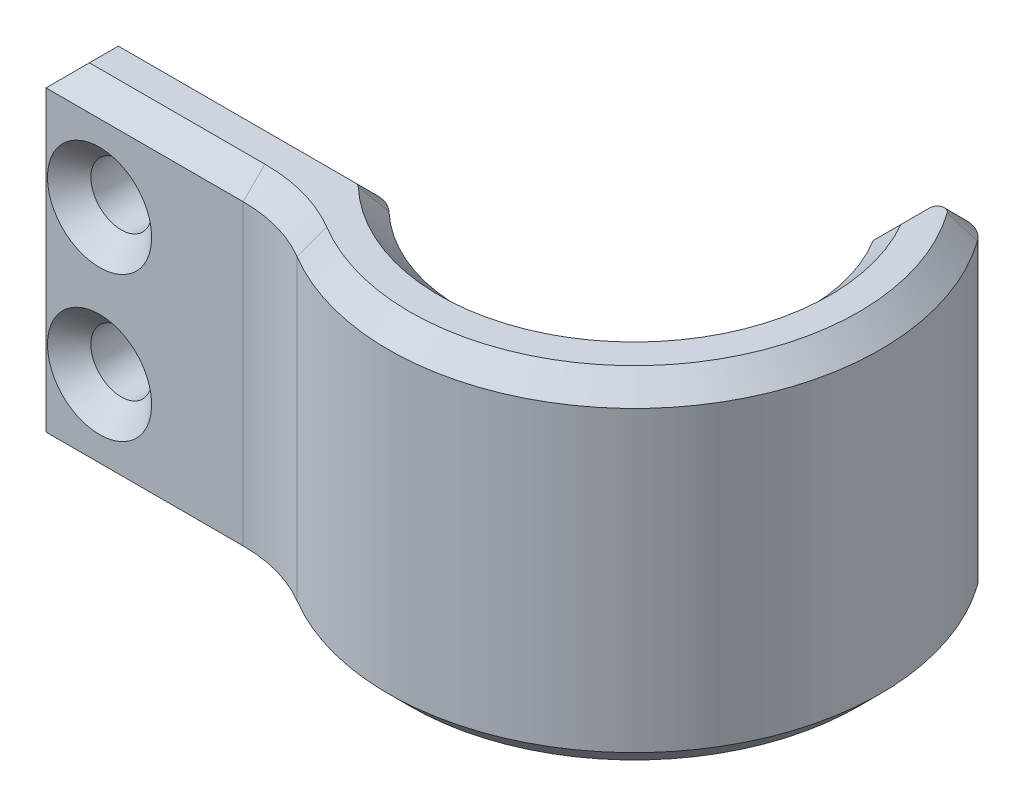
from build123d import *

# Parameters (mm, degrees)
CROQUIS1_W                          = 15.5
CROQUIS1_H                          = 23.6
CROQUIS1_R                          = 2.1
SALIENTE_EXTRUIR1_DEPTH             = 5
SALIENTE_EXTRUIR2_REACH             = 40.26
SALIENTE_EXTRUIR2_DIRECTION_2_REACH = 40.26
REDONDEO1_R                         = 2
REDONDEO2_R                         = 10
CHAFL_N1_SIZE                       = 1.5
CHAFL_N2_SIZE                       = 1.5


with BuildPart() as part:
    # Croquis1 → Saliente-Extruir1 (new body)
    with BuildSketch(Plane.XY):
        with Locations((28.3, 0)):
            Rectangle(CROQUIS1_W, CROQUIS1_H)
        with Locations((24.250000128, -5)):
            Circle(CROQUIS1_R, mode=Mode.SUBTRACT)
        with Locations((24.250000128, 5)):
            Circle(CROQUIS1_R, mode=Mode.SUBTRACT)
    extrude(amount=SALIENTE_EXTRUIR1_DEPTH)

    # Saliente-Extruir2: up to this face of the body (flat: up to its plane)
    saliente_extruir2_end = Plane(part.part.faces().sort_by_distance((28.3, -11.8, 2.5))[0])
    # Croquis2 → Saliente-Extruir2 (add, up to the picked face)
    with BuildSketch(Plane(origin=(0, 0, 0), x_dir=(1, 0, 0), z_dir=(0, 1, 0)), mode=Mode.PRIVATE) as saliente_extruir2_sk1:
        with BuildLine():
            Line((36.05, 0), (36.05, -5))
            Line((36.05, -5), (37.292908876, -5))
            ThreePointArc((37.292908876, -5), (61.427658114, -2.326136764), (58.268482288, 21.749894336))
            Line((58.268482288, 21.749894336), (58.268482288, 14.455247679))
            ThreePointArc((58.268482288, 14.455247679), (55.312581622, -1.388967795), (39.254957851, 0))
            Line((39.254957851, 0), (36.05, 0))
        make_face()
    saliente_extruir2_tool1 = split(extrude(saliente_extruir2_sk1.sketch, amount=-SALIENTE_EXTRUIR2_REACH, mode=Mode.PRIVATE), bisect_by=saliente_extruir2_end, keep=Keep.BOTH, mode=Mode.PRIVATE)
    add(saliente_extruir2_tool1.solids().sort_by(Axis((37.652479, 0, 0.421487), (0, -1, 0)))[0])

    # Saliente-Extruir2 direction 2: up to this face of the body (flat: up to its plane)
    saliente_extruir2_direction_2_end = Plane(part.part.faces().sort_by_distance((28.3, 11.8, 2.5))[0])
    # Croquis2 → Saliente-Extruir2 direction 2 (add, up to the picked face)
    with BuildSketch(Plane(origin=(0, 0, 0), x_dir=(1, 0, 0), z_dir=(0, 1, 0)), mode=Mode.PRIVATE) as saliente_extruir2_direction_2_sk1:
        with BuildLine():
            Line((36.05, 0), (36.05, -5))
            Line((36.05, -5), (37.292908876, -5))
            ThreePointArc((37.292908876, -5), (61.427658114, -2.326136764), (58.268482288, 21.749894336))
            Line((58.268482288, 21.749894336), (58.268482288, 14.455247679))
            ThreePointArc((58.268482288, 14.455247679), (55.312581622, -1.388967795), (39.254957851, 0))
            Line((39.254957851, 0), (36.05, 0))
        make_face()
    saliente_extruir2_direction_2_tool1 = split(extrude(saliente_extruir2_direction_2_sk1.sketch, amount=SALIENTE_EXTRUIR2_DIRECTION_2_REACH, mode=Mode.PRIVATE), bisect_by=saliente_extruir2_direction_2_end, keep=Keep.BOTH, mode=Mode.PRIVATE)
    add(saliente_extruir2_direction_2_tool1.solids().sort_by(Axis((37.652479, 0, 0.421487), (0, 1, 0)))[0])

    # Redondeo1
    redondeo1_edges = [part.edges().sort_by_distance(p)[0] for p in [
        (39.254957851, 0, 0),
        (58.268482288, 0, -21.749894336),
    ]]
    fillet(redondeo1_edges, radius=REDONDEO1_R)

    # Redondeo2
    redondeo2_edges = [part.edges().sort_by_distance(p)[0] for p in [
        (37.292908876, 0, 5),
    ]]
    fillet(redondeo2_edges, radius=REDONDEO2_R)

    # Chaflán1
    chafl_n1_edges = [part.edges().sort_by_distance(p)[0] for p in [
        (58.268482288, 11.8, -15.660048739),
        (59.659492117, 11.8, -18.769877613),
        (60.537424453, 11.8, 3.37157131),
        (36.843099013, 11.8, 5.361749074),
        (27.363871837, 11.8, 5),
        (20.55, 11.8, 2.5),
        (29.486018705, 11.8, 0),
        (39.162329274, 11.8, 0.142052757),
        (55.615767212, 11.8, 1.150684381),
        (20.55, -11.8, 2.5),
        (27.363871837, -11.8, 5),
        (36.843099013, -11.8, 5.361749074),
        (60.537424453, -11.8, 3.37157131),
        (59.659492117, -11.8, -18.769877613),
        (58.268482288, -11.8, -15.660048739),
        (55.615767212, -11.8, 1.150684381),
        (39.162329274, -11.8, 0.142052757),
        (29.486018705, -11.8, 0),
    ]]
    chamfer(chafl_n1_edges, length=CHAFL_N1_SIZE)

    # Chaflán2
    chafl_n2_edges = [part.edges().sort_by_distance(p)[0] for p in [
        (22.150000128, 5, 5),
        (22.150000128, -5, 5),
    ]]
    chamfer(chafl_n2_edges, length=CHAFL_N2_SIZE)


solid = part.part
